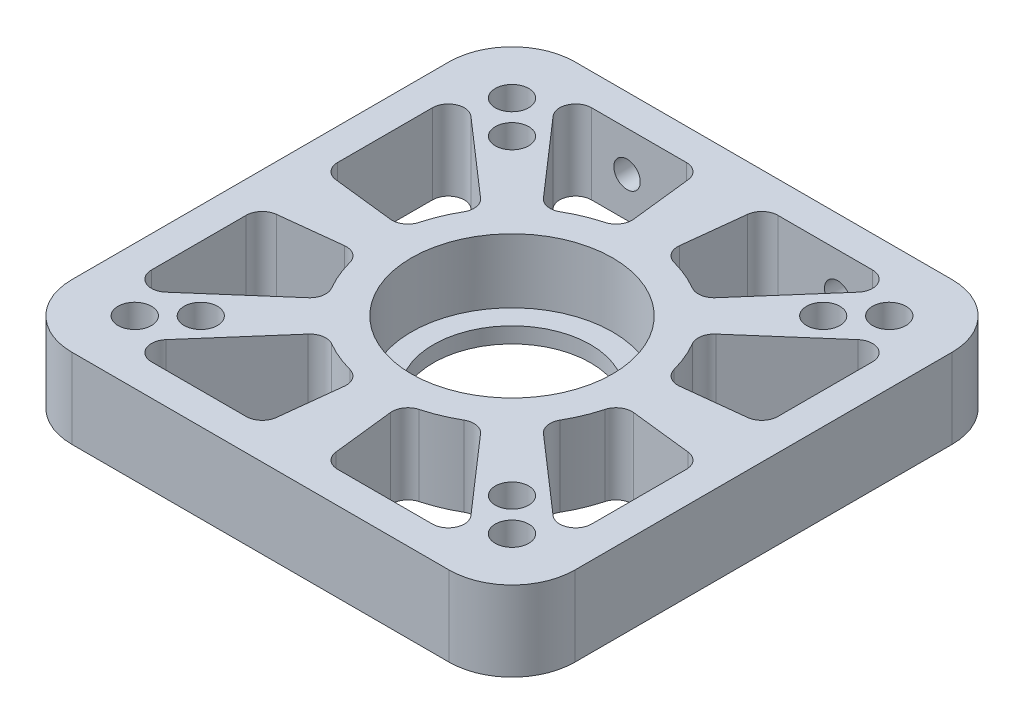
from build123d import *

# Parameters (mm, degrees)
SKETCH1_W                 = 80
SKETCH1_H                 = 80
SKETCH1_R                 = 16
BOSS_EXTRUDE1_DEPTH       = 12.7
CUT_EXTRUDE1_REACH        = 59.977
SKETCH2_R                 = 2.655
FILLET1_R                 = 10
CUT_EXTRUDE2_REACH        = 59.977
SKETCH3_R                 = 2.665
CUT_EXTRUDE3_REACH        = 59.977
FILLET2_R                 = 2.54
FILLET2_OF_MIRROR1_R      = 2.54
CIRPATTERN1_DEPTH         = 12.7
M5X0_8_TAPPED_HOLE1_D     = 4.2
M5X0_8_TAPPED_HOLE1_DEPTH = 5
SKETCH7_R                 = 16
SKETCH7_R_2               = 12.5
BOSS_EXTRUDE2_DEPTH       = 2.5


# Read off the part's stored shape, not the designer's step: CirPattern1
with BuildPart() as part:
    # Sketch1 → Boss-Extrude1 (new body)
    with BuildSketch(Plane(origin=(0, 0, 0), x_dir=(1, 0, 0), z_dir=(0, 1, 0))):
        Rectangle(SKETCH1_W, SKETCH1_H)
        with Locations(Location((0, 0, 0), (0, 0, 270))):
            Circle(SKETCH1_R, mode=Mode.SUBTRACT)
    extrude(amount=BOSS_EXTRUDE1_DEPTH)

    # Sketch2 → Cut-Extrude1 (cut, up to next)
    with BuildSketch(Plane(origin=(0, 12.7, 0), x_dir=(1, 0, 0), z_dir=(0, 1, 0)), mode=Mode.PRIVATE) as cut_extrude1_sk1:
        with Locations(Location((24.748737342, 24.748737342, 0), (0, 0, 270))):
            Circle(SKETCH2_R)
    cut_extrude1_tool1 = extrude(cut_extrude1_sk1.sketch, amount=-CUT_EXTRUDE1_REACH, mode=Mode.PRIVATE) & part.part
    # Sketch2 → Cut-Extrude1 (cut, up to next)
    with BuildSketch(Plane(origin=(0, 12.7, 0), x_dir=(1, 0, 0), z_dir=(0, 1, 0)), mode=Mode.PRIVATE) as cut_extrude1_sk2:
        with Locations(Location((-24.748737342, 24.748737342, 0), (0, 0, 270))):
            Circle(SKETCH2_R)
    cut_extrude1_tool2 = extrude(cut_extrude1_sk2.sketch, amount=-CUT_EXTRUDE1_REACH, mode=Mode.PRIVATE) & part.part
    # Sketch2 → Cut-Extrude1 (cut, up to next)
    with BuildSketch(Plane(origin=(0, 12.7, 0), x_dir=(1, 0, 0), z_dir=(0, 1, 0)), mode=Mode.PRIVATE) as cut_extrude1_sk3:
        with Locations(Location((24.748737342, -24.748737342, 0), (0, 0, 270))):
            Circle(SKETCH2_R)
    cut_extrude1_tool3 = extrude(cut_extrude1_sk3.sketch, amount=-CUT_EXTRUDE1_REACH, mode=Mode.PRIVATE) & part.part
    # Sketch2 → Cut-Extrude1 (cut, up to next)
    with BuildSketch(Plane(origin=(0, 12.7, 0), x_dir=(1, 0, 0), z_dir=(0, 1, 0)), mode=Mode.PRIVATE) as cut_extrude1_sk4:
        with Locations(Location((-24.748737342, -24.748737342, 0), (0, 0, 270))):
            Circle(SKETCH2_R)
    cut_extrude1_tool4 = extrude(cut_extrude1_sk4.sketch, amount=-CUT_EXTRUDE1_REACH, mode=Mode.PRIVATE) & part.part
    add(cut_extrude1_tool1.solids().sort_by_distance((24.748737, 12.7, -24.748737))[0], mode=Mode.SUBTRACT)
    add(cut_extrude1_tool2.solids().sort_by_distance((-24.748737, 12.7, -24.748737))[0], mode=Mode.SUBTRACT)
    add(cut_extrude1_tool3.solids().sort_by_distance((24.748737, 12.7, 24.748737))[0], mode=Mode.SUBTRACT)
    add(cut_extrude1_tool4.solids().sort_by_distance((-24.748737, 12.7, 24.748737))[0], mode=Mode.SUBTRACT)

    # Fillet1
    fillet1_edges = [part.edges().sort_by_distance(p)[0] for p in [
        (40, 6.35, 40),
        (-40, 6.35, 40),
        (-40, 6.35, -40),
        (40, 6.35, -40),
    ]]
    fillet(fillet1_edges, radius=FILLET1_R)

    # Sketch3 → Cut-Extrude2 (cut, up to next)
    with BuildSketch(Plane(origin=(0, 12.7, 0), x_dir=(1, 0, 0), z_dir=(0, 1, 0)), mode=Mode.PRIVATE) as cut_extrude2_sk1:
        with Locations(Location((-30, 30, 0), (0, 0, 270))):
            Circle(SKETCH3_R)
    cut_extrude2_tool1 = extrude(cut_extrude2_sk1.sketch, amount=-CUT_EXTRUDE2_REACH, mode=Mode.PRIVATE) & part.part
    # Sketch3 → Cut-Extrude2 (cut, up to next)
    with BuildSketch(Plane(origin=(0, 12.7, 0), x_dir=(1, 0, 0), z_dir=(0, 1, 0)), mode=Mode.PRIVATE) as cut_extrude2_sk2:
        with Locations(Location((30, 30, 0), (0, 0, 270))):
            Circle(SKETCH3_R)
    cut_extrude2_tool2 = extrude(cut_extrude2_sk2.sketch, amount=-CUT_EXTRUDE2_REACH, mode=Mode.PRIVATE) & part.part
    # Sketch3 → Cut-Extrude2 (cut, up to next)
    with BuildSketch(Plane(origin=(0, 12.7, 0), x_dir=(1, 0, 0), z_dir=(0, 1, 0)), mode=Mode.PRIVATE) as cut_extrude2_sk3:
        with Locations(Location((30, -30, 0), (0, 0, 270))):
            Circle(SKETCH3_R)
    cut_extrude2_tool3 = extrude(cut_extrude2_sk3.sketch, amount=-CUT_EXTRUDE2_REACH, mode=Mode.PRIVATE) & part.part
    # Sketch3 → Cut-Extrude2 (cut, up to next)
    with BuildSketch(Plane(origin=(0, 12.7, 0), x_dir=(1, 0, 0), z_dir=(0, 1, 0)), mode=Mode.PRIVATE) as cut_extrude2_sk4:
        with Locations(Location((-30, -30, 0), (0, 0, 270))):
            Circle(SKETCH3_R)
    cut_extrude2_tool4 = extrude(cut_extrude2_sk4.sketch, amount=-CUT_EXTRUDE2_REACH, mode=Mode.PRIVATE) & part.part
    add(cut_extrude2_tool1.solids().sort_by_distance((-30, 12.7, -30))[0], mode=Mode.SUBTRACT)
    add(cut_extrude2_tool2.solids().sort_by_distance((30, 12.7, -30))[0], mode=Mode.SUBTRACT)
    add(cut_extrude2_tool3.solids().sort_by_distance((30, 12.7, 30))[0], mode=Mode.SUBTRACT)
    add(cut_extrude2_tool4.solids().sort_by_distance((-30, 12.7, 30))[0], mode=Mode.SUBTRACT)

    # Sketch4 → Cut-Extrude3 (cut, up to next)
    with BuildSketch(Plane(origin=(0, 12.7, 0), x_dir=(1, 0, 0), z_dir=(0, 1, 0)), mode=Mode.PRIVATE) as cut_extrude3_sk1:
        with BuildLine():
            Line((-5, 35), (-27.928932188, 35))
            Line((-27.928932188, 35), (-12.259782216, 17.049860411))
            ThreePointArc((-12.259782216, 17.049860411), (-8.03635208, 19.401470183), (-3.387096774, 20.725047055))
            Line((-3.387096774, 20.725047055), (-5, 35))
        make_face()
    cut_extrude3_tool1 = extrude(cut_extrude3_sk1.sketch, amount=-CUT_EXTRUDE3_REACH, mode=Mode.PRIVATE) & part.part
    cut_extrude3 = cut_extrude3_tool1.solids().sort_by_distance((-13.138354, 12.7, -27.973836))[0]
    add(cut_extrude3, mode=Mode.SUBTRACT)

    # Fillet2
    fillet2_edges = [part.edges().sort_by_distance(p)[0] for p in [
        (-12.259782216, 6.35, -17.049860411),
        (-27.928932188, 6.35, -35),
        (-5, 6.35, -35),
        (-3.387096774, 6.35, -20.725047055),
    ]]
    fillet(fillet2_edges, radius=FILLET2_R)

    # Mirror1: Cut-Extrude3 across plane
    add(cut_extrude3.mirror(Plane(origin=(0, 0, 0), x_dir=(0, 0, 1), z_dir=(1, 0, 0))), mode=Mode.SUBTRACT)

    # Fillet2 of Mirror1
    fillet2_of_mirror1_edges = [part.edges().sort_by_distance(p)[0] for p in [
        (12.259782216, 6.35, -17.049860411),
        (27.928932188, 6.35, -35),
        (5, 6.35, -35),
        (3.387096774, 6.35, -20.725047055),
    ]]
    fillet(fillet2_of_mirror1_edges, radius=FILLET2_OF_MIRROR1_R)

    # CirPattern1 outline → CirPattern1 (cut)
    with BuildSketch(Plane(origin=(0, 0, 0), x_dir=(1, 0, 0), z_dir=(0, 1, 0))):
        with BuildLine():
            ThreePointArc((18.176050002, 10.518137018), (19.384019181, 8.078353817), (20.26620798, 5.50280057))
            ThreePointArc((20.26620798, 5.50280057), (21.29044889, 4.067126305), (23.002629913, 3.644437079))
            Line((23.002629913, 3.644437079), (32.745175825, 4.745231161))
            ThreePointArc((32.745175825, 4.745231161), (34.35419463, 5.576946113), (35, 7.269171483))
            Line((35, 7.269171483), (35, 22.340093991))
            ThreePointArc((35, 22.340093991), (33.510928831, 24.652484225), (30.789646778, 24.253603885))
            Line((30.789646778, 24.253603885), (18.704133304, 13.703840627))
            ThreePointArc((18.704133304, 13.703840627), (17.868681187, 12.205709601), (18.176050002, 10.518137018))
        make_face()
        with BuildLine():
            ThreePointArc((-18.176050002, -10.518137018), (-19.384019181, -8.078353817), (-20.26620798, -5.50280057))
            ThreePointArc((-20.26620798, -5.50280057), (-21.29044889, -4.067126305), (-23.002629913, -3.644437079))
            Line((-23.002629913, -3.644437079), (-32.745175825, -4.745231161))
            ThreePointArc((-32.745175825, -4.745231161), (-34.35419463, -5.576946113), (-35, -7.269171483))
            Line((-35, -7.269171483), (-35, -22.340093991))
            ThreePointArc((-35, -22.340093991), (-33.510928831, -24.652484225), (-30.789646778, -24.253603885))
            Line((-30.789646778, -24.253603885), (-18.704133304, -13.703840627))
            ThreePointArc((-18.704133304, -13.703840627), (-17.868681187, -12.205709601), (-18.176050002, -10.518137018))
        make_face()
        with BuildLine():
            ThreePointArc((10.518137018, -18.176050002), (8.078353817, -19.384019181), (5.50280057, -20.26620798))
            ThreePointArc((5.50280057, -20.26620798), (4.067126305, -21.29044889), (3.644437079, -23.002629913))
            Line((3.644437079, -23.002629913), (4.745231161, -32.745175825))
            ThreePointArc((4.745231161, -32.745175825), (5.576946113, -34.35419463), (7.269171483, -35))
            Line((7.269171483, -35), (22.340093991, -35))
            ThreePointArc((22.340093991, -35), (24.652484225, -33.510928831), (24.253603885, -30.789646778))
            Line((24.253603885, -30.789646778), (13.703840627, -18.704133304))
            ThreePointArc((13.703840627, -18.704133304), (12.205709601, -17.868681187), (10.518137018, -18.176050002))
        make_face()
        with BuildLine():
            ThreePointArc((20.26620798, -5.50280057), (19.384019181, -8.078353817), (18.176050002, -10.518137018))
            ThreePointArc((18.176050002, -10.518137018), (17.868681187, -12.205709601), (18.704133304, -13.703840627))
            Line((18.704133304, -13.703840627), (30.789646778, -24.253603885))
            ThreePointArc((30.789646778, -24.253603885), (33.510928831, -24.652484225), (35, -22.340093991))
            Line((35, -22.340093991), (35, -7.269171483))
            ThreePointArc((35, -7.269171483), (34.35419463, -5.576946113), (32.745175825, -4.745231161))
            Line((32.745175825, -4.745231161), (23.002629913, -3.644437079))
            ThreePointArc((23.002629913, -3.644437079), (21.29044889, -4.067126305), (20.26620798, -5.50280057))
        make_face()
        with BuildLine():
            ThreePointArc((-5.50280057, -20.26620798), (-8.078353817, -19.384019181), (-10.518137018, -18.176050002))
            ThreePointArc((-10.518137018, -18.176050002), (-12.205709601, -17.868681187), (-13.703840627, -18.704133304))
            Line((-13.703840627, -18.704133304), (-24.253603885, -30.789646778))
            ThreePointArc((-24.253603885, -30.789646778), (-24.652484225, -33.510928831), (-22.340093991, -35))
            Line((-22.340093991, -35), (-7.269171483, -35))
            ThreePointArc((-7.269171483, -35), (-5.576946113, -34.35419463), (-4.745231161, -32.745175825))
            Line((-4.745231161, -32.745175825), (-3.644437079, -23.002629913))
            ThreePointArc((-3.644437079, -23.002629913), (-4.067126305, -21.29044889), (-5.50280057, -20.26620798))
        make_face()
        with BuildLine():
            ThreePointArc((-20.26620798, 5.50280057), (-19.384019181, 8.078353817), (-18.176050002, 10.518137018))
            ThreePointArc((-18.176050002, 10.518137018), (-17.868681187, 12.205709601), (-18.704133304, 13.703840627))
            Line((-18.704133304, 13.703840627), (-30.789646778, 24.253603885))
            ThreePointArc((-30.789646778, 24.253603885), (-33.510928831, 24.652484225), (-35, 22.340093991))
            Line((-35, 22.340093991), (-35, 7.269171483))
            ThreePointArc((-35, 7.269171483), (-34.35419463, 5.576946113), (-32.745175825, 4.745231161))
            Line((-32.745175825, 4.745231161), (-23.002629913, 3.644437079))
            ThreePointArc((-23.002629913, 3.644437079), (-21.29044889, 4.067126305), (-20.26620798, 5.50280057))
        make_face()
    extrude(amount=CIRPATTERN1_DEPTH, mode=Mode.SUBTRACT)

    # M5x0.8 Tapped Hole1
    with Locations(Plane(origin=(-16.7, 6.35, -40), x_dir=(-1, 0, 0), z_dir=(0, 0, -1))):
        with Locations((0, 0), (-33.5, 0)):
            Hole(M5X0_8_TAPPED_HOLE1_D / 2, depth=M5X0_8_TAPPED_HOLE1_DEPTH)

    # Sketch7 → Boss-Extrude2 (add)
    with BuildSketch(Plane.XZ):
        with Locations(Location((0, 0, 0), (0, 0, 270))):
            Circle(SKETCH7_R)
        with Locations(Location((0, 0, 0), (0, 0, 270))):
            Circle(SKETCH7_R_2, mode=Mode.SUBTRACT)
    extrude(amount=-BOSS_EXTRUDE2_DEPTH)


solid = part.part
